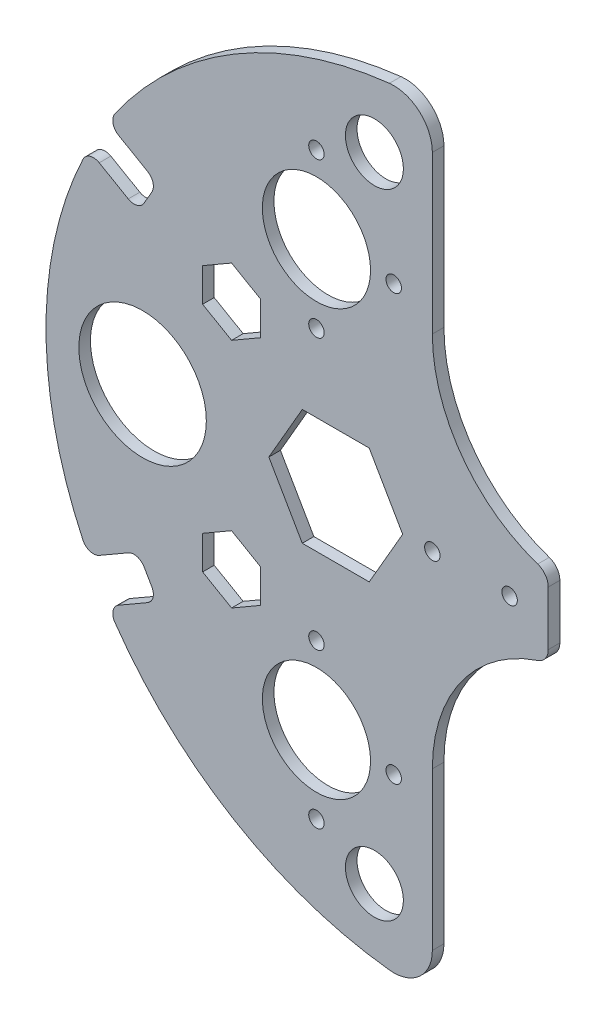
from build123d import *

# Parameters (mm, degrees)
SKETCH_2_R             = 2
SKETCH_2_R_2           = 14
SKETCH_2_R_3           = 16.5
SKETCH_2_W             = 30
SKETCH_2_H             = 20
EXTRUDE_1_DEPTH        = 3
FILLET_1_R             = 40
FILLET_2_R             = 10
SKETCH_3_R             = 7.5
CUT_EXTRUDE_1_DEPTH    = 142.05975465
FILLET_3_R             = 3
FILLET_3_OF_MIRROR_1_R = 3
SKETCH_4_R             = 2
CUT_EXTRUDE_2_DEPTH    = 142.05975465
FILLET_4_R             = 4


with BuildPart() as part:
    # 草图2 → 凸台-拉伸1 (new body)
    # profile 1 of 2: a face of its own
    with BuildSketch(Plane.XY):
        with BuildLine():
            Line((0, 10), (0, 100))
            ThreePointArc((0, 100), (-100, 0), (0, -100))
            Line((0, -100), (0, -10))
            Line((0, -10), (0, 10))
        make_face()
        with Locations((-30, -75)):
            Circle(SKETCH_2_R, mode=Mode.SUBTRACT)
        with Locations((-30, -55)):
            Circle(SKETCH_2_R_2, mode=Mode.SUBTRACT)
        with Locations((-10, -55)):
            Circle(SKETCH_2_R, mode=Mode.SUBTRACT)
        with Locations((-30, -35)):
            Circle(SKETCH_2_R, mode=Mode.SUBTRACT)
        with Locations((-75, 0)):
            Circle(SKETCH_2_R_3, mode=Mode.SUBTRACT)
        with Locations((-30, 35)):
            Circle(SKETCH_2_R, mode=Mode.SUBTRACT)
        with Locations((-30, 55)):
            Circle(SKETCH_2_R_2, mode=Mode.SUBTRACT)
        with Locations((-10, 55)):
            Circle(SKETCH_2_R, mode=Mode.SUBTRACT)
        with Locations((-30, 75)):
            Circle(SKETCH_2_R, mode=Mode.SUBTRACT)
    # profile 2 of 2: a face of its own
    with BuildSketch(Plane.XY):
        with Locations((15, 0)):
            Rectangle(SKETCH_2_W, SKETCH_2_H)
    extrude(amount=EXTRUDE_1_DEPTH)

    # 圆角1
    # the kernel refuses this fillet: 40 mm, written as the material it adds along each edge
    with BuildSketch(Plane(origin=(0, 10, 0), x_dir=(0, 1, 0), z_dir=(0, 0, 1))) as fillet_1_piece_1:
        with BuildLine():
            CenterArc((38.729833462, -40), FILLET_1_R, 90, 75.522487814)
            Line((0, -30), (-0.774596669, -29.8))
            ThreePointArc((-0.774596669, -29.8), (-0.8, -15), (-0.8, 0))
            Line((-0.8, 0), (0, 0.8))
            Line((0, 0.8), (38.729833462, 0.8))
            Line((38.729833462, 0.8), (38.729833462, 0))
        make_face()
    extrude(amount=3)
    with BuildSketch(Plane(origin=(0, -10, 0), x_dir=(0, -1, 0), z_dir=(0, 0, 1))) as fillet_1_piece_2:
        with BuildLine():
            CenterArc((38.729833462, 40), FILLET_1_R, 194.477512186, 75.522487814)
            Line((0, 30), (-0.774596669, 29.8))
            ThreePointArc((-0.774596669, 29.8), (-0.8, 15), (-0.8, 0))
            Line((-0.8, 0), (0, -0.8))
            Line((0, -0.8), (38.729833462, -0.8))
            Line((38.729833462, -0.8), (38.729833462, 0))
        make_face()
    extrude(amount=3)

    # 圆角2
    fillet_2_edges = [part.edges().sort_by_distance(p)[0] for p in [
        (0, 100, 1.5),
        (0, -100, 1.5),
    ]]
    fillet(fillet_2_edges, radius=FILLET_2_R)

    # 草图3 → 切除-拉伸1 (cut, through all)
    with BuildSketch(Plane.XY.offset(3)):
        with BuildLine():
            Line((-76.112159322, 38.169872981), (-71.112159322, 46.830127019))
            Line((-71.112159322, 46.830127019), (-83.99421946, 54.267587908))
            ThreePointArc((-83.99421946, 54.267587908), (-86.602540378, 50), (-88.99421946, 45.60733387))
            Line((-88.99421946, 45.60733387), (-76.112159322, 38.169872981))
        make_face()
        Polygon((-42.320508076, 0), (-33.660254038, -15), (-16.339745962, -15), (-7.679491924, 0), (-16.339745962, 15), (-33.660254038, 15), align=None)
        Polygon((-59.461524227, 34.330127019), (-59.461524227, 25.669872981), (-51.961524227, 21.339745962), (-44.461524227, 25.669872981), (-44.461524227, 34.330127019), (-51.961524227, 38.660254038), align=None)
        with Locations((-15, 82)):
            Circle(SKETCH_3_R)
    cut_extrude_1 = extrude(amount=-CUT_EXTRUDE_1_DEPTH, mode=Mode.SUBTRACT)

    # 圆角3
    fillet_3_edges = [part.edges().sort_by_distance(p)[0] for p in [
        (-71.112159322, 46.830127019, 1.5),
        (-76.112159322, 38.169872981, 1.5),
        (-88.99421946, 45.60733387, 1.5),
        (-83.99421946, 54.267587908, 1.5),
    ]]
    fillet(fillet_3_edges, radius=FILLET_3_R)

    # 镜向1: 切除-拉伸1 across plane
    add(cut_extrude_1.mirror(Plane.ZX), mode=Mode.SUBTRACT)

    # 圆角3 of 镜向1
    fillet_3_of_mirror_1_edges = [part.edges().sort_by_distance(p)[0] for p in [
        (-71.112159322, -46.830127019, 1.5),
        (-76.112159322, -38.169872981, 1.5),
        (-88.99421946, -45.60733387, 1.5),
        (-83.99421946, -54.267587908, 1.5),
    ]]
    fillet(fillet_3_of_mirror_1_edges, radius=FILLET_3_OF_MIRROR_1_R)

    # 草图4 → 切除-拉伸2 (cut, through all)
    with BuildSketch(Plane.XY.offset(3)):
        with Locations((20, 0)):
            Circle(SKETCH_4_R)
        Circle(SKETCH_4_R)
    extrude(amount=-CUT_EXTRUDE_2_DEPTH, mode=Mode.SUBTRACT)

    # 圆角4
    fillet_4_edges = [part.edges().sort_by_distance(p)[0] for p in [
        (30, 10, 1.5),
        (30, -10, 1.5),
    ]]
    fillet(fillet_4_edges, radius=FILLET_4_R)


solid = part.part
